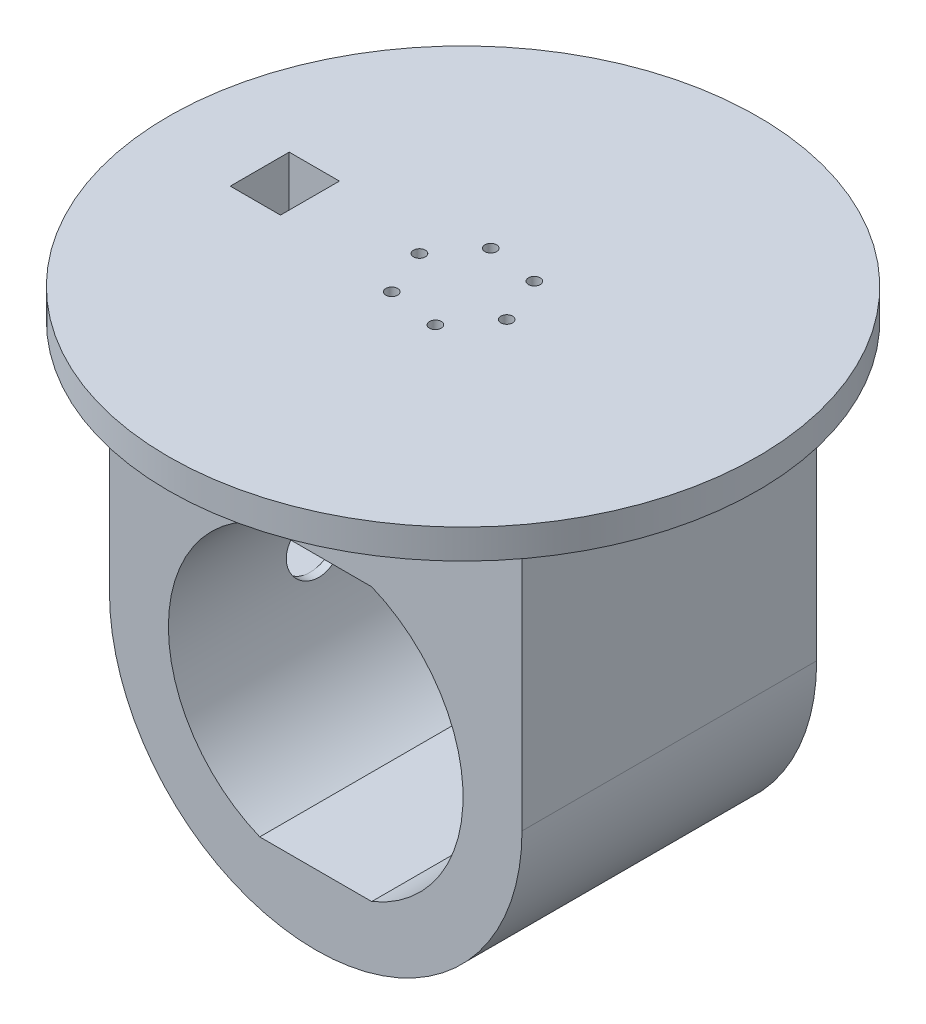
from build123d import *

# Parameters (mm, degrees)
SKETCH_1_R          = 100
EXTRUDE_1_DEPTH     = 10
SKETCH_2_W          = 140
SKETCH_2_H          = 100
EXTRUDE_2_DEPTH     = 160.00000000000009
FILLET_1_R          = 70
FILLET_2_R          = 70
SKETCH_3_R          = 50
CUT_EXTRUDE_1_DEPTH = 160.00000000000009
CUT_EXTRUDE_START   = -1
SKETCH_13_R         = 9.999999999999998
CUT_EXTRUDE_5_DEPTH = 25
SKETCH_9_W          = 53.30531277978001
SKETCH_9_H          = 9.28529014360771
EXTRUDE_3_DEPTH     = 100
SKETCH_14_R         = 50
CUT_EXTRUDE_6_DEPTH = 7.7
SKETCH_15_W         = 17.036633895131082
SKETCH_15_H         = 20
CUT_EXTRUDE_7_DEPTH = 110.00000000000001
SKETCH_16_R         = 2.0000000000000036
SKETCH_16_R_2       = 2.000000000000005
SKETCH_16_R_3       = 2.0000000000000013
SKETCH_16_R_4       = 2.0000000000000027
SKETCH_16_R_5       = 2.0000000000000044
CUT_EXTRUDE_8_DEPTH = 10


with BuildPart() as part:
    # 草图1 → 凸台-拉伸1 (new body)
    with BuildSketch(Plane(origin=(0, 0, 0), x_dir=(1, 0, 0), z_dir=(0, 1, 0))):
        with Locations(Location((0, 0, 0), (0, 0, 270))):
            Circle(SKETCH_1_R)
    extrude(amount=EXTRUDE_1_DEPTH)

    # 草图2 → 凸台-拉伸2 (add)
    with BuildSketch(Plane(origin=(0, 0, 0), x_dir=(1, 0, 0), z_dir=(0, 1, 0))):
        Rectangle(SKETCH_2_W, SKETCH_2_H)
    extrude(amount=-EXTRUDE_2_DEPTH)

    # 圆角1
    fillet_1_edges = [part.edges().sort_by_distance(p)[0] for p in [
        (-70.00000000000001, -160.00000000000009, 7.11e-15),
    ]]
    fillet(fillet_1_edges, radius=FILLET_1_R)

    # 圆角2
    fillet_2_edges = [part.edges().sort_by_distance(p)[0] for p in [
        (69.99999999999999, -160.00000000000009, 7.11e-15),
    ]]
    fillet(fillet_2_edges, radius=FILLET_2_R - 0.0001)  # a hair under: the kernel refuses the full size

    # 草图3 → 切除-拉伸1 (cut)
    with BuildSketch(Plane(origin=(0, 0, -49.99999999999999), x_dir=(-1, 0, 0), z_dir=(0, 0, -1))):
        with Locations((0, -90)):
            Circle(SKETCH_3_R)
    extrude(amount=-CUT_EXTRUDE_1_DEPTH, mode=Mode.SUBTRACT)

    # 草图13 → 切除-拉伸5 (cut)
    with BuildSketch(Plane.ZY.offset(70.00000000000001).offset(CUT_EXTRUDE_START)):
        with Locations((6.94e-15, -90.00000000000009)):
            Circle(SKETCH_13_R)
    extrude(amount=-CUT_EXTRUDE_5_DEPTH, mode=Mode.SUBTRACT)

    # 草图9 → 凸台-拉伸3 (add)
    with BuildSketch(Plane(origin=(0, 0, -49.99999999999999), x_dir=(-1, 0, 0), z_dir=(0, 0, -1))):
        with Locations((0.3436291461197136, -140.89264507180383)):
            Rectangle(SKETCH_9_W, SKETCH_9_H)
        Polygon((-23.87404930056264, -43.75), (22.298543315194763, -43.75), (22.298543315194763, -37.81707315136096), (-23.87404930056264, -37.817073151360965), align=None)
    extrude(amount=-EXTRUDE_3_DEPTH)

    # 草图14 → 切除-拉伸6 (cut)
    with BuildSketch(Plane(origin=(0, 0, -49.99999999999999), x_dir=(-1, 0, 0), z_dir=(0, 0, -1))):
        with Locations((0, -90)):
            Circle(SKETCH_14_R)
    extrude(amount=-CUT_EXTRUDE_6_DEPTH, mode=Mode.SUBTRACT)

    # 草图15 → 切除-拉伸7 (cut)
    with BuildSketch(Plane(origin=(0, 10, 0), x_dir=(1, 0, 0), z_dir=(0, 1, 0))):
        with Locations((-60.48168305243448, -7.11e-15)):
            Rectangle(SKETCH_15_W, SKETCH_15_H)
    extrude(amount=-CUT_EXTRUDE_7_DEPTH, mode=Mode.SUBTRACT)

    # 草图16 → 切除-拉伸8 (cut)
    with BuildSketch(Plane(origin=(0, 10, 0), x_dir=(1, 0, 0), z_dir=(0, 1, 0))):
        with Locations(Location((10.537986720028217, 13.656988536588477, 0), (0, 0, 270))):
            Circle(SKETCH_16_R)
        with Locations(Location((17.09629237189259, -2.2976699359932877, 0), (0, 0, 270))):
            Circle(SKETCH_16_R_2)
        with Locations(Location((6.558305651864305, -15.954658472581762, 0), (0, 0, 270))):
            Circle(SKETCH_16_R_3)
        with Locations(Location((-10.537986720028309, -13.656988536588404, 0), (0, 0, 270))):
            Circle(SKETCH_16_R_4)
        with Locations(Location((-17.09629237189257, 2.2976699359934125, 0), (0, 0, 270))):
            Circle(SKETCH_16_R_4)
        with Locations(Location((-6.558305651864193, 15.954658472581803, 0), (0, 0, 270))):
            Circle(SKETCH_16_R_5)
    extrude(amount=-CUT_EXTRUDE_8_DEPTH, mode=Mode.SUBTRACT)


solid = part.part
